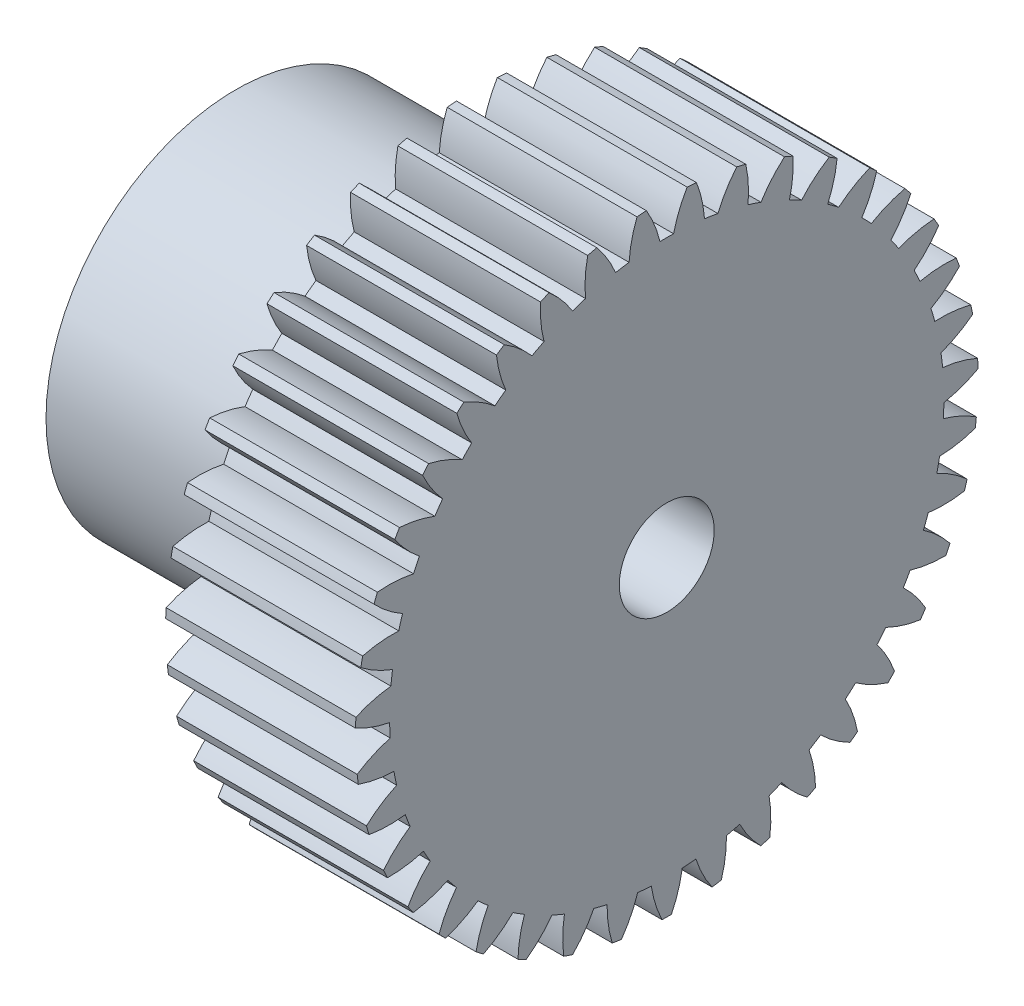
from build123d import *

# Parameters (mm, degrees)
BASPROSKE_W      = 10
BASPROSKE_H      = 16.4
TOOTHCUT_DEPTH   = 26.257078216
TEETHCUTS_COUNT  = 39
TEETHCUTS_ANGLE  = 350.769230769
HUBNEAONESKE_R   = 10
HUBNEARONE_DEPTH = 12.7000508
BORSKE_R         = 2.5
BORE_DEPTH       = 10.0000508


with BuildPart() as part:
    # BasProSke → Base-Revolve (revolve)
    with BuildSketch(Plane(origin=(0, 0, 0), x_dir=(1, 0, 0), z_dir=(0, 1, 0))):
        with Locations((5, 8.2)):
            Rectangle(BASPROSKE_W, BASPROSKE_H)
    revolve(axis=Axis((-10, 0, 0), (1, 0, 0)))

    # TooCutSke → ToothCut (cut, through all)
    with BuildSketch(Plane(origin=(0, 0, 0), x_dir=(0, 0, -1), z_dir=(1, 0, 0))):
        with BuildLine():
            ThreePointArc((0.35934894, 14.59457671), (0, 14.599), (-0.35934894, 14.59457671))
            ThreePointArc((-0.35934894, 14.59457671), (-0.653910463, 15.520403912), (-1.088613769, 16.389285684))
            ThreePointArc((-1.088613769, 16.389285684), (0, 16.4254), (1.088613769, 16.389285684))
            ThreePointArc((1.088613769, 16.389285684), (0.653910463, 15.520403912), (0.35934894, 14.59457671))
        make_face()
    toothcut = extrude(amount=TOOTHCUT_DEPTH, mode=Mode.SUBTRACT)

    # TeethCuts: ToothCut ×39 about axis
    teethcuts_axis = Axis((-10, 0, 0), (1, 0, 0))
    for i in range(1, TEETHCUTS_COUNT):
        add(toothcut.rotate(teethcuts_axis, i * TEETHCUTS_ANGLE / (TEETHCUTS_COUNT - 1)), mode=Mode.SUBTRACT)

    # HubNeaOneSke → HubNearOne (add)
    with BuildSketch(Plane.ZY):
        Circle(HUBNEAONESKE_R)
    extrude(amount=HUBNEARONE_DEPTH)

    # BorSke → Bore (cut, symmetric)
    with BuildSketch(Plane(origin=(0, 0, 0), x_dir=(0, 0, -1), z_dir=(1, 0, 0))):
        Circle(BORSKE_R)
    extrude(amount=BORE_DEPTH, both=True, mode=Mode.SUBTRACT)


solid = part.part
